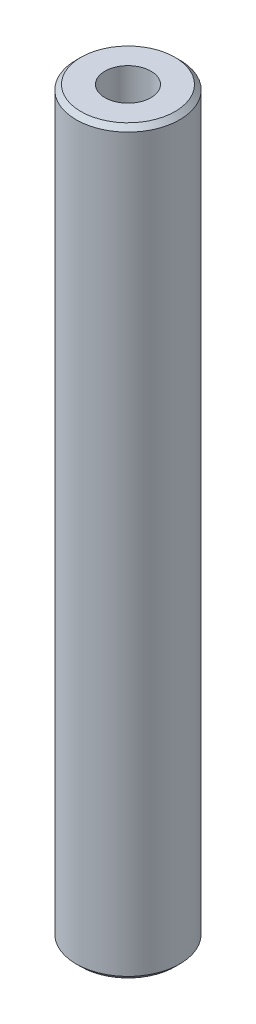
from build123d import *

# Parameters (mm, degrees)
SKETCH1_R           = 7.5
BOSS_EXTRUDE1_DEPTH = 107.26477866
SKETCH2_R           = 3.332550186
CUT_EXTRUDE1_DEPTH  = 108.787906284
CHAMFER1_SIZE       = 0.686863984


with BuildPart() as part:
    # Sketch1 → Boss-Extrude1 (new body)
    with BuildSketch(Plane(origin=(0, 0, 0), x_dir=(1, 0, 0), z_dir=(0, 1, 0))):
        Circle(SKETCH1_R)
    extrude(amount=BOSS_EXTRUDE1_DEPTH)

    # Sketch2 → Cut-Extrude1 (cut, through all)
    with BuildSketch(Plane(origin=(0, 0, 0), x_dir=(1, 0, 0), z_dir=(0, 1, 0))):
        Circle(SKETCH2_R)
    extrude(amount=CUT_EXTRUDE1_DEPTH, mode=Mode.SUBTRACT)

    # Chamfer1
    chamfer1_edges = [part.edges().sort_by_distance(p)[0] for p in [
        (-7.5, 107.26477866, 0),
        (-7.5, 0, 0),
    ]]
    chamfer(chamfer1_edges, length=CHAMFER1_SIZE)


solid = part.part
